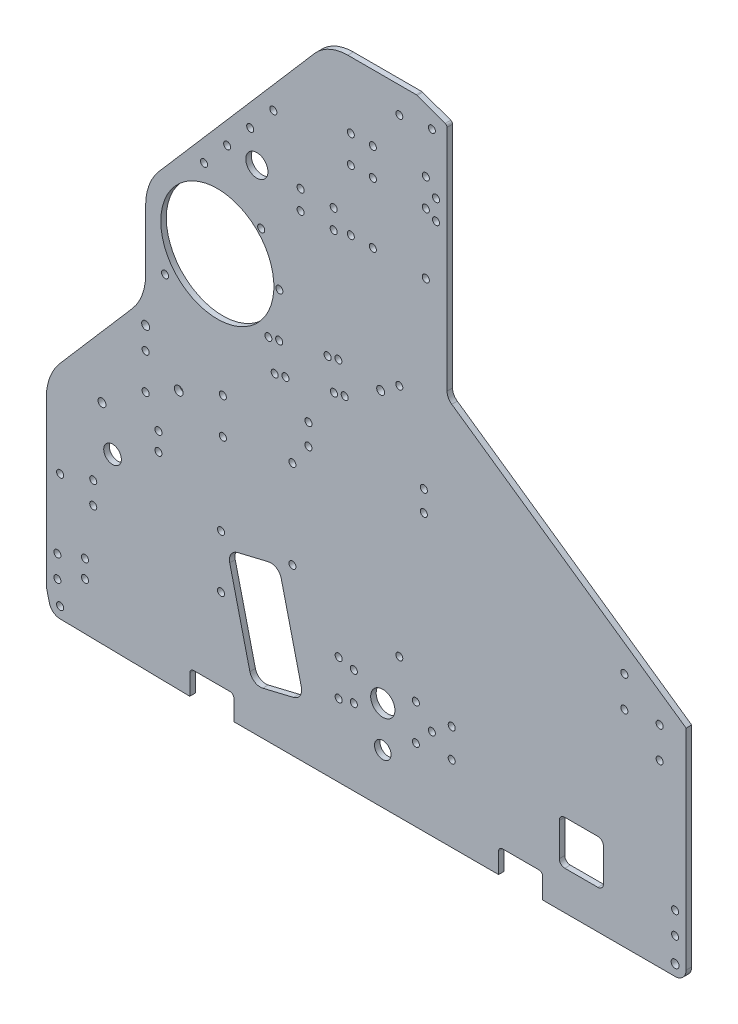
from build123d import *

# Parameters (mm, degrees)
SKETCH1_R           = 2.032
SKETCH1_R_2         = 5.08
SKETCH1_R_3         = 2.54
SKETCH1_R_4         = 2
BOSS_EXTRUDE1_DEPTH = 3.175
FILLET1_R           = 2.286
FILLET2_R           = 6.35
SKETCH2_R           = 2.032
CUT_EXTRUDE1_DEPTH  = 505.524983177
FILLET3_R           = 1.5875
SKETCH3_R           = 2.032
SKETCH3_R_2         = 2.286
CUT_EXTRUDE2_DEPTH  = 505.524983177
SKETCH4_R           = 2.032
SKETCH4_R_2         = 6.985
SKETCH4_R_3         = 4.7625
CUT_EXTRUDE3_DEPTH  = 505.524983177
SKETCH5_R           = 32.54375
SKETCH5_R_2         = 2.286000001
CUT_EXTRUDE5_DEPTH  = 505.524983177
FILLET4_R           = 31.75
CUT_EXTRUDE6_DEPTH  = 505.524983177
FILLET5_R           = 25.4
SKETCH8_R           = 2.032000002
SKETCH8_R_2         = 2.031999999
SKETCH8_R_3         = 2.031999998
CUT_EXTRUDE7_DEPTH  = 505.524983177
SKETCH10_R          = 2.032
CUT_EXTRUDE8_DEPTH  = 505.524983177
FILLET6_R           = 6.35
SKETCH11_RX         = 2.032
SKETCH11_RY         = 2.031999502
CUT_EXTRUDE9_DEPTH  = 505.524983177
SKETCH12_R          = 2.032
CUT_EXTRUDE10_DEPTH = 505.524983319
SKETCH14_R          = 6.375981846
CUT_EXTRUDE11_DEPTH = 505.524983319
SKETCH15_R          = 2.286
CUT_EXTRUDE12_DEPTH = 505.524983319


with BuildPart() as part:
    # Sketch1 → Boss-Extrude1 (new body)
    with BuildSketch(Plane.XY):
        with BuildLine():
            Line((7.829508682, -19.049081656), (82.55, -20.32))
            Line((82.55, -20.32), (82.55, -6.35))
            Line((82.55, -6.35), (107.95, -6.35))
            Line((107.95, -6.35), (107.95, -20.32))
            Line((107.95, -20.32), (260.35, -20.32))
            Line((260.35, -20.32), (260.35, -6.35))
            Line((260.35, -6.35), (285.75, -6.35))
            Line((285.75, -6.35), (285.75, -20.32))
            Line((285.75, -20.32), (368.3, -20.32))
            Line((368.3, -20.32), (368.3, 106.68))
            Line((368.3, 106.68), (230.66375, 202.565))
            Line((230.66375, 202.565), (230.66375, 338.455))
            Line((230.66375, 338.455), (213.19998, 344.805))
            Line((213.19998, 344.805), (203.2, 344.805))
            Line((203.2, 344.805), (161.925, 344.805))
            Line((161.925, 344.805), (52.720122664, 218.469945827))
            ThreePointArc((52.720122664, 218.469945827), (52.803835479, 218.142145922), (52.832, 217.805))
            ThreePointArc((52.832, 217.805), (52.095493096, 216.239521914), (50.419872403, 215.808871996))
            Line((50.419872403, 215.808871996), (0, 157.48))
            Line((0, 157.48), (0, 0))
            Line((0, 0), (0, -6.35))
            ThreePointArc((0, -6.35), (0.047577015, -7.125863724), (0.189595124, -7.890101219))
            Line((0.189595124, -7.890101219), (1.777095124, -14.240101219))
            ThreePointArc((1.777095124, -14.240101219), (3.987212552, -17.671692778), (7.829508682, -19.049081656))
        make_face()
        with Locations((7.9375, -12.7)):
            Circle(SKETCH1_R, mode=Mode.SUBTRACT)
        with Locations((6.35, 0)):
            Circle(SKETCH1_R, mode=Mode.SUBTRACT)
        with Locations((6.35, 12.7)):
            Circle(SKETCH1_R, mode=Mode.SUBTRACT)
        with Locations((38.1, 78.105)):
            Circle(SKETCH1_R_2, mode=Mode.SUBTRACT)
        with Locations((57.15, 118.58625)):
            Circle(SKETCH1_R, mode=Mode.SUBTRACT)
        with Locations((57.15, 139.22375)):
            Circle(SKETCH1_R, mode=Mode.SUBTRACT)
        with Locations((76.2, 128.905)):
            Circle(SKETCH1_R_3, mode=Mode.SUBTRACT)
        with Locations((101.6, 118.58625)):
            Circle(SKETCH1_R, mode=Mode.SUBTRACT)
        with Locations((101.6, 139.22375)):
            Circle(SKETCH1_R, mode=Mode.SUBTRACT)
        with Locations((203.2, 59.805)):
            Circle(SKETCH1_R_4, mode=Mode.SUBTRACT)
        with Locations((361.95, 0)):
            Circle(SKETCH1_R, mode=Mode.SUBTRACT)
        with Locations((361.95, 12.7)):
            Circle(SKETCH1_R, mode=Mode.SUBTRACT)
        with Locations((353.06, 82.955052336)):
            Circle(SKETCH1_R, mode=Mode.SUBTRACT)
        with Locations((332.74, 98.195052336)):
            Circle(SKETCH1_R, mode=Mode.SUBTRACT)
        with Locations((332.74, 115.975052336)):
            Circle(SKETCH1_R, mode=Mode.SUBTRACT)
        with Locations((353.06, 100.735052336)):
            Circle(SKETCH1_R, mode=Mode.SUBTRACT)
        with Locations((68.326, 182.923674932)):
            Circle(SKETCH1_R, mode=Mode.SUBTRACT)
        with Locations((76.2, 217.805)):
            Circle(SKETCH1_R, mode=Mode.SUBTRACT)
        with Locations((90.779500502, 249.682)):
            Circle(SKETCH1_R, mode=Mode.SUBTRACT)
        with Locations((104.067838673, 265.054783374)):
            Circle(SKETCH1_R, mode=Mode.SUBTRACT)
        with Locations((117.356176844, 280.427566748)):
            Circle(SKETCH1_R, mode=Mode.SUBTRACT)
        with Locations((130.644515014, 295.800350122)):
            Circle(SKETCH1_R, mode=Mode.SUBTRACT)
        with Locations((203.2, 194.805)):
            Circle(SKETCH1_R_4, mode=Mode.SUBTRACT)
        with Locations((224.31375, 287.401)):
            Circle(SKETCH1_R, mode=Mode.SUBTRACT)
        with Locations((224.31375, 298.831)):
            Circle(SKETCH1_R, mode=Mode.SUBTRACT)
        with Locations((203.2, 329.805)):
            Circle(SKETCH1_R_4, mode=Mode.SUBTRACT)
        with Locations((221.931865, 332.105)):
            Circle(SKETCH1_R_4, mode=Mode.SUBTRACT)
    extrude(amount=BOSS_EXTRUDE1_DEPTH)

    # Fillet1
    fillet1_edges = [part.edges().sort_by_distance(p)[0] for p in [
        (285.75, -6.35, 1.5875),
        (107.95, -6.35, 1.5875),
        (260.35, -6.35, 1.5875),
        (82.55, -6.35, 1.5875),
    ]]
    fillet(fillet1_edges, radius=FILLET1_R)

    # Fillet2
    fillet2_edges = [part.edges().sort_by_distance(p)[0] for p in [
        (230.66375, 202.565, 1.5875),
    ]]
    fillet(fillet2_edges, radius=FILLET2_R)

    # Sketch2 → Cut-Extrude1 (cut, through all)
    with BuildSketch(Plane(origin=(0, 0, 0), x_dir=(-1, 0, 0), z_dir=(0, 0, -1))):
        with Locations((-100.552770272, 71.086035298)):
            Circle(SKETCH2_R)
        with Locations((-100.552770272, 40.606035298)):
            Circle(SKETCH2_R)
        with Locations((-22.225, 18.202541089)):
            Circle(SKETCH2_R)
        with Locations((-22.225, 8.042541089)):
            Circle(SKETCH2_R)
    extrude(amount=-CUT_EXTRUDE1_DEPTH, mode=Mode.SUBTRACT)

    # Fillet3
    fillet3_edges = [part.edges().sort_by_distance(p)[0] for p in [
        (230.66375, 338.455, 1.5875),
        (213.19998, 344.805, 1.5875),
    ]]
    fillet(fillet3_edges, radius=FILLET3_R)

    # Sketch3 → Cut-Extrude2 (cut, through all)
    with BuildSketch(Plane.XY.offset(3.175)):
        with BuildLine():
            Line((127.789350211, 69.359774106), (110.090750339, 65.117184968))
            ThreePointArc((110.090750339, 65.117184968), (106.287939856, 62.356288953), (105.55119507, 57.715047577))
            Line((105.55119507, 57.715047577), (117.160037875, 9.287010566))
            ThreePointArc((117.160037875, 9.287010566), (119.92093389, 5.484200083), (124.562175266, 4.747455297))
            Line((124.562175266, 4.747455297), (142.260775137, 8.990044434))
            ThreePointArc((142.260775137, 8.990044434), (146.063585621, 11.75094045), (146.800330407, 16.392181825))
            Line((146.800330407, 16.392181825), (135.191487602, 64.820218836))
            ThreePointArc((135.191487602, 64.820218836), (132.430591586, 68.62302932), (127.789350211, 69.359774106))
        make_face()
        with Locations((26.987500002, 46.953113935)):
            Circle(SKETCH3_R)
        with Locations((26.987500002, 59.653113935)):
            Circle(SKETCH3_R)
        with Locations((7.937500002, 53.303113935)):
            Circle(SKETCH3_R)
        with Locations((32.030600738, 100.810868776)):
            Circle(SKETCH3_R_2)
        with Locations((64.525942114, 102.94048958)):
            Circle(SKETCH3_R)
        with Locations((64.525942114, 92.525786339)):
            Circle(SKETCH3_R)
        with Locations((134.14375, 208.228121768)):
            Circle(SKETCH3_R)
        with Locations((123.681970341, 233.485092108)):
            Circle(SKETCH3_R)
    extrude(amount=-CUT_EXTRUDE2_DEPTH, mode=Mode.SUBTRACT)

    # Sketch4 → Cut-Extrude3 (cut, through all)
    with BuildSketch(Plane.XY.offset(3.175)):
        with Locations((168.275, 42.06875)):
            Circle(SKETCH4_R)
        with Locations((212.725, 42.06875)):
            Circle(SKETCH4_R)
        with Locations((212.725, 21.43125)):
            Circle(SKETCH4_R)
        with Locations((168.275, 21.43125)):
            Circle(SKETCH4_R)
        with Locations((193.675, 31.75)):
            Circle(SKETCH4_R_2)
        with Locations((177.00498, 40.0431)):
            Circle(SKETCH4_R)
        with Locations((177.00498, 23.4569)):
            Circle(SKETCH4_R)
        with Locations((193.675, 8.466666658)):
            Circle(SKETCH4_R_3)
        with Locations((221.931865, 31.75)):
            Circle(SKETCH4_R)
        with Locations((233.36123, 23.4569)):
            Circle(SKETCH4_R)
        with Locations((233.36123, 40.0431)):
            Circle(SKETCH4_R)
    extrude(amount=-CUT_EXTRUDE3_DEPTH, mode=Mode.SUBTRACT)

    # Sketch5 → Cut-Extrude5 (cut, through all)
    with BuildSketch(Plane(origin=(0, 0, 0), x_dir=(-1, 0, 0), z_dir=(0, 0, -1))):
        Polygon((0, 157.48), (-57.15, 223.594705882), (-57.15, 165.333696112), (0, 99.218990229), align=None)
        with Locations((-98.425, 208.228121768)):
            Circle(SKETCH5_R)
        with Locations((-361.95, -13.97)):
            Circle(SKETCH5_R_2)
    extrude(amount=-CUT_EXTRUDE5_DEPTH, mode=Mode.SUBTRACT)

    # Fillet4
    fillet4_edges = [part.edges().sort_by_distance(p)[0] for p in [
        (0, 99.218990229, 1.5875),
        (57.15, 165.333696112, 1.5875),
        (57.15, 223.594705882, 1.5875),
    ]]
    fillet(fillet4_edges, radius=FILLET4_R)

    # Sketch6 → Cut-Extrude6 (cut, through all)
    with BuildSketch(Plane.XY.offset(3.175)):
        with BuildLine():
            Line((298.45, 27.305), (317.5, 27.305))
            ThreePointArc((317.5, 27.305), (319.74506403, 26.37506403), (320.675, 24.13))
            Line((320.675, 24.13), (320.675, 5.08))
            ThreePointArc((320.675, 5.08), (319.74506403, 2.83493597), (317.5, 1.905))
            Line((317.5, 1.905), (298.45, 1.905))
            ThreePointArc((298.45, 1.905), (296.20493597, 2.83493597), (295.275, 5.08))
            Line((295.275, 5.08), (295.275, 24.13))
            ThreePointArc((295.275, 24.13), (296.20493597, 26.37506403), (298.45, 27.305))
        make_face()
    extrude(amount=-CUT_EXTRUDE6_DEPTH, mode=Mode.SUBTRACT)

    # Fillet5
    fillet5_edges = [part.edges().sort_by_distance(p)[0] for p in [
        (161.925, 344.805, 1.5875),
    ]]
    fillet(fillet5_edges, radius=FILLET5_R)

    # Sketch8 → Cut-Extrude7 (cut, through all)
    with BuildSketch(Plane(origin=(0, 0, 0), x_dir=(-1, 0, 0), z_dir=(0, 0, -1))):
        with Locations((-218.44, 290.83)):
            Circle(SKETCH8_R)
        with Locations((-187.96, 290.83)):
            Circle(SKETCH8_R)
        with Locations((-187.96, 306.70500001)):
            Circle(SKETCH8_R_2)
        with Locations((-175.26, 290.83)):
            Circle(SKETCH8_R)
        with Locations((-187.96, 255.905)):
            Circle(SKETCH8_R)
        with Locations((-218.44, 306.70500001)):
            Circle(SKETCH8_R_3)
        with Locations((-175.26, 306.70500001)):
            Circle(SKETCH8_R_2)
        with Locations((-175.26, 255.905)):
            Circle(SKETCH8_R)
        with Locations((-218.44, 255.905)):
            Circle(SKETCH8_R)
    extrude(amount=-CUT_EXTRUDE7_DEPTH, mode=Mode.SUBTRACT)

    # Sketch10 → Cut-Extrude8 (cut, through all)
    with BuildSketch(Plane.XY.offset(3.175)):
        with Locations((141.64248, 74.684371768)):
            Circle(SKETCH10_R)
        with Locations((141.64248, 125.484371768)):
            Circle(SKETCH10_R)
    extrude(amount=-CUT_EXTRUDE8_DEPTH, mode=Mode.SUBTRACT)

    # Fillet6
    fillet6_edges = [part.edges().sort_by_distance(p)[0] for p in [
        (368.3, -20.32, 1.5875),
    ]]
    fillet(fillet6_edges, radius=FILLET6_R)

    # Sketch11 → Cut-Extrude9 (cut, through all)
    with BuildSketch(Plane.XY.offset(3.175)):
        with Locations(Location((150.881424454, 138.43), (0, 0, 90))):
            Ellipse(SKETCH11_RX, SKETCH11_RY)
        with Locations(Location((150.881424454, 150.495), (0, 0, 90))):
            Ellipse(SKETCH11_RX, SKETCH11_RY)
        with Locations(Location((217.30240818, 150.495), (0, 0, 90))):
            Ellipse(SKETCH11_RX, SKETCH11_RY)
        with Locations(Location((217.30240818, 138.43), (0, 0, 90))):
            Ellipse(SKETCH11_RX, SKETCH11_RY)
    extrude(amount=-CUT_EXTRUDE9_DEPTH, mode=Mode.SUBTRACT)

    # Sketch12 → Cut-Extrude10 (cut, through all)
    with BuildSketch(Plane(origin=(0, 0, 0), x_dir=(-1, 0, 0), z_dir=(0, 0, -1))):
        with Locations((-165.4175, 264.63498)):
            Circle(SKETCH12_R)
        with Locations((-165.4175, 253.52248)):
            Circle(SKETCH12_R)
        with Locations((-146.3675, 253.52248)):
            Circle(SKETCH12_R)
        with Locations((-146.3675, 264.63498)):
            Circle(SKETCH12_R)
    extrude(amount=-CUT_EXTRUDE10_DEPTH, mode=Mode.SUBTRACT)

    # Sketch14 → Cut-Extrude11 (cut, through all)
    with BuildSketch(Plane(origin=(0, 0, 0), x_dir=(-1, 0, 0), z_dir=(0, 0, -1))):
        with Locations((-121.184716432, 263.688494682)):
            Circle(SKETCH14_R)
    extrude(amount=-CUT_EXTRUDE11_DEPTH, mode=Mode.SUBTRACT)

    # Sketch15 → Cut-Extrude12 (cut, through all)
    with BuildSketch(Plane.XY.offset(3.175)):
        with Locations((57.15, 151.92375)):
            Circle(SKETCH15_R)
        with Locations((192.439038956, 187.119947783)):
            Circle(SKETCH15_R)
        with BuildLine():
            ThreePointArc((163.873739892, 173.680575348), (163.573171662, 172.102507308), (164.512499361, 170.799317578))
            ThreePointArc((164.512499361, 170.799317578), (167.540838635, 172.982117899), (163.873739892, 173.680575348))
        make_face()
        with BuildLine():
            ThreePointArc((173.43975005, 172.778441408), (173.74031828, 174.356509448), (172.800990581, 175.659699178))
            ThreePointArc((172.800990581, 175.659699178), (169.772651307, 173.476898857), (173.43975005, 172.778441408))
        make_face()
        with BuildLine():
            ThreePointArc((169.158852977, 192.088320238), (166.130513704, 189.905519916), (169.797612447, 189.207062467))
            ThreePointArc((169.797612447, 189.207062467), (170.098180676, 190.785130507), (169.158852977, 192.088320238))
        make_face()
        with BuildLine():
            ThreePointArc((160.231602288, 190.109196408), (159.931034058, 188.531128368), (160.870361758, 187.227938638))
            ThreePointArc((160.870361758, 187.227938638), (163.898701031, 189.410738959), (160.231602288, 190.109196408))
        make_face()
        with BuildLine():
            ThreePointArc((129.776601843, 166.121421831), (129.476033613, 164.543353791), (130.415361312, 163.240164061))
            ThreePointArc((130.415361312, 163.240164061), (133.443700586, 165.422964382), (129.776601843, 166.121421831))
        make_face()
        with BuildLine():
            ThreePointArc((139.342612002, 165.219287891), (139.643180231, 166.797355931), (138.703852532, 168.100545661))
            ThreePointArc((138.703852532, 168.100545661), (135.675513258, 165.91774534), (139.342612002, 165.219287891))
        make_face()
        with BuildLine():
            ThreePointArc((135.700474398, 181.647908951), (136.001042628, 183.225976991), (135.061714929, 184.529166721))
            ThreePointArc((135.061714929, 184.529166721), (132.033375655, 182.3463664), (135.700474398, 181.647908951))
        make_face()
        with BuildLine():
            ThreePointArc((126.134464239, 182.550042891), (125.83389601, 180.971974851), (126.773223709, 179.668785121))
            ThreePointArc((126.773223709, 179.668785121), (129.801562983, 181.851585442), (126.134464239, 182.550042891))
        make_face()
    extrude(amount=-CUT_EXTRUDE12_DEPTH, mode=Mode.SUBTRACT)


solid = part.part
